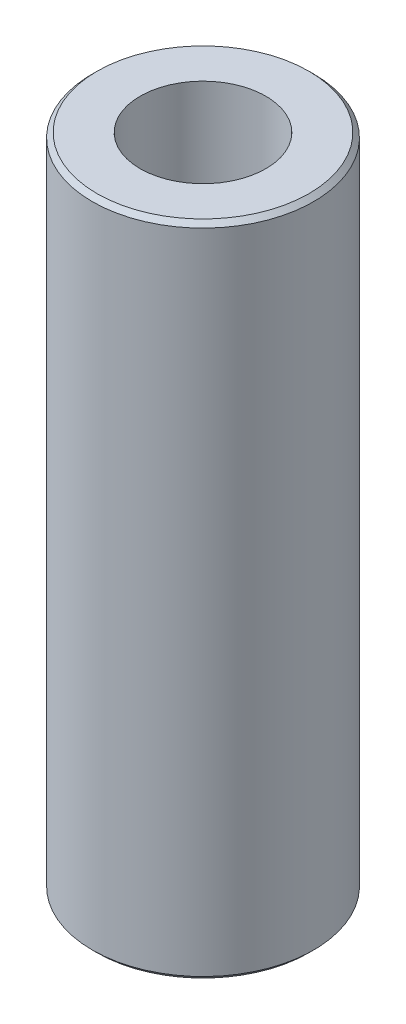
from build123d import *

# Parameters (mm, degrees)
SKETCH1_R           = 32.5
BOSS_EXTRUDE1_DEPTH = 193.108476641
SKETCH2_R           = 18.460230137
CUT_EXTRUDE1_DEPTH  = 199.502855774
CHAMFER1_SIZE       = 1.365686153


with BuildPart() as part:
    # Sketch1 → Boss-Extrude1 (new body)
    with BuildSketch(Plane(origin=(0, 0, 0), x_dir=(1, 0, 0), z_dir=(0, 1, 0))):
        Circle(SKETCH1_R)
    extrude(amount=BOSS_EXTRUDE1_DEPTH)

    # Sketch2 → Cut-Extrude1 (cut, through all)
    with BuildSketch(Plane(origin=(0, 0, 0), x_dir=(1, 0, 0), z_dir=(0, 1, 0))):
        Circle(SKETCH2_R)
    extrude(amount=CUT_EXTRUDE1_DEPTH, mode=Mode.SUBTRACT)

    # Chamfer1
    chamfer1_edges = [part.edges().sort_by_distance(p)[0] for p in [
        (-32.5, 193.108476641, 0),
        (-32.5, 0, 0),
    ]]
    chamfer(chamfer1_edges, length=CHAMFER1_SIZE)


solid = part.part
